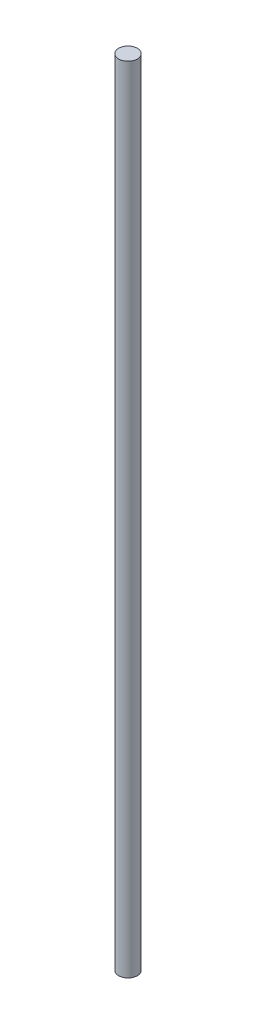
from build123d import *

# Parameters (mm, degrees)
SKETCH1_R           = 4
BOSS_EXTRUDE1_DEPTH = 340


with BuildPart() as part:
    # Sketch1 → Boss-Extrude1 (new body)
    with BuildSketch(Plane(origin=(0, 0, 0), x_dir=(1, 0, 0), z_dir=(0, 1, 0))):
        Circle(SKETCH1_R)
    extrude(amount=BOSS_EXTRUDE1_DEPTH)


solid = part.part
